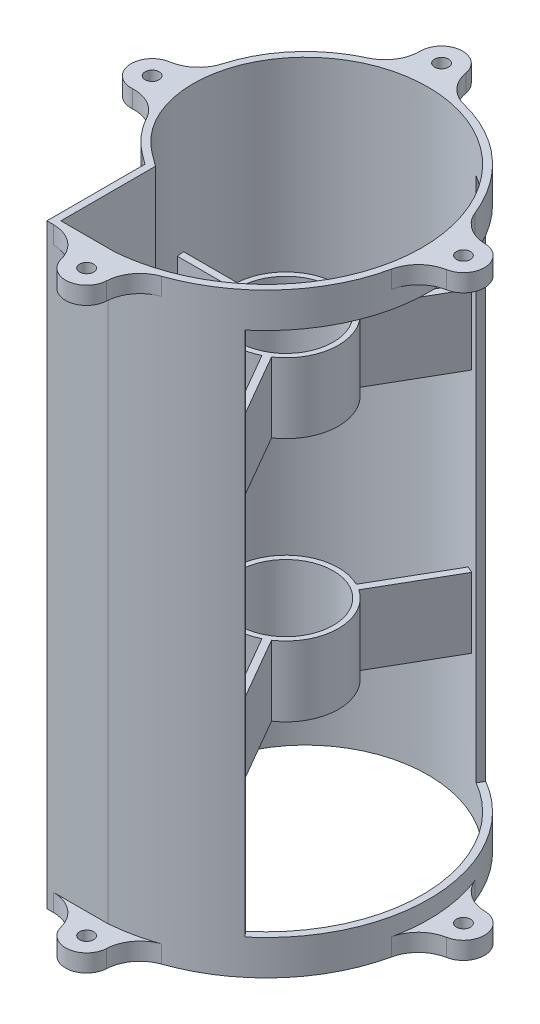
from build123d import *

# Parameters (mm, degrees)
BOSS_EXTRUDE1_DEPTH     = 170
SKETCH5_3_R             = 6
SKETCH5_3_R_2           = 2
BOSS_EXTRUDE2_DEPTH     = 5
BOSS_EXTRUDE3_START     = -165
SKETCH5_4_R             = 6
SKETCH5_4_R_2           = 2
BOSS_EXTRUDE3_DEPTH     = 5
BOSS_EXTRUDE4_START     = -40
SKETCH6_R               = 15
SKETCH6_R_2             = 13.5
BOSS_EXTRUDE4_DEPTH     = 20
BOSS_EXTRUDE5_START     = -130
BOSS_EXTRUDE5_OUTLINE_R = 13.5
BOSS_EXTRUDE5_DEPTH     = 20
CUT_EXTRUDE1_START      = -10
CUT_EXTRUDE1_DEPTH      = 150


# Read off the part's stored shape, not the designer's step: Boss-Extrude5
with BuildPart() as part:
    # Sketch5 → Boss-Extrude1 (new body)
    with BuildSketch(Plane(origin=(0, 0, 0), x_dir=(1, 0, 0), z_dir=(0, 1, 0))):
        with BuildLine():
            add(Edge.make_bspline(
                [(-20.284806523, -20.697166147), (-21.647349282, -19.684628715), (-24.119876423, -17.487215029), (-26.521142183, -14.482412357), (-28.133703758, -11.951961048), (-29.652422792, -9.185663116), (-30.974716714, -5.758772787), (-32.056848653, -1.249302628), (-32.484723085, 2.832387859), (-32.298334481, 6.996928933), (-31.67751169, 11.165076454), (-30.558556828, 15.070848597), (-27.690305049, 21.551018706), (-22.847250329, 28.074967355), (-15.468817121, 33.530688185), (-9.913327734, 36.09195539), (-5.810944088, 37.369461116), (-1.635876871, 38.286376333), (2.643306278, 38.67228751), (6.934651208, 38.518823782), (11.233189994, 38.009461291), (18.419798413, 36.233096755), (28.406731461, 31.050278753), (36.149602779, 22.96265335), (40.631649152, 15.13900289), (42.553931903, 10.306844764), (43.70793417, 6.061253764), (44.536683673, 1.759406891), (44.883797443, -2.636875779), (44.743754077, -7.029105777), (44.282387222, -11.426694793), (43.03375203, -17.158865746), (39.358782218, -26.649232757), (32.967215553, -35.534238949), (24.30152126, -42.623106564), (18.394766853, -45.948962523), (14.06903476, -47.736845229), (11.362814445, -48.684248187), (8.290318717, -49.580816442), (4.432881146, -50.401863914), (1.532426722, -50.75686291), (0.081274739, -50.875)],
                knots=[0, 0, 0, 0, 0.031259421, 0.061044233, 0.068859088, 0.084488799, 0.11657261, 0.13220232, 0.163461741, 0.185156677, 0.200786388, 0.232045809, 0.250075368, 0.31259421, 0.35533086, 0.386049678, 0.401620291, 0.417190905, 0.447064906, 0.462001906, 0.476938907, 0.506812908, 0.562669578, 0.62518842, 0.649396808, 0.676419158, 0.689930334, 0.703733536, 0.730171833, 0.743390981, 0.756610129, 0.783048426, 0.812744946, 0.875263788, 0.906523209, 0.93778263, 0.949935808, 0.957750663, 0.969042051, 0.984671761, 1.000301472, 1.000301472, 1.000301472, 1.000301472], degree=3))
            Line((0.081274739, -50.875), (-17.346722006, -50.875))
            Line((-17.346722006, -50.875), (-17.346722006, -22.880525557))
            Line((-17.346722006, -22.880525557), (-20.284806523, -20.697166147))
        make_face()
        with BuildLine():
            Line((-19.091883092, -19.091883092), (-15.346722006, -21.875))
            Line((-15.346722006, -21.875), (-15.346722006, -48.875))
            Line((-15.346722006, -48.875), (0, -48.875))
            add(Edge.make_bspline(
                [(-19.091883092, -19.091883092), (-20.346373407, -18.159641961), (-21.534500259, -17.105433619), (-23.732871388, -14.775446479), (-24.743062189, -13.499686256), (-26.544205363, -10.757384747), (-27.335107738, -9.290871933), (-28.661787584, -6.205556015), (-29.197520359, -4.586790607), (-29.984871355, -1.242166207), (-30.236451872, 0.483646875), (-30.43464802, 3.991722319), (-30.381234435, 5.773931869), (-29.957740861, 9.340194634), (-29.587641391, 11.124189719), (-28.52895847, 14.63712725), (-27.840366222, 16.366008053), (-26.153191727, 19.711333954), (-25.154611982, 21.327715866), (-22.866364526, 24.392054471), (-21.576710867, 25.839948515), (-18.735378004, 28.514611155), (-17.183724268, 29.74131975), (-13.857020421, 31.926048607), (-12.082006674, 32.884013594), (-8.355848884, 34.490566919), (-6.404751203, 35.139106683), (-2.381083742, 36.094561163), (-0.308569074, 36.401435807), (3.897409442, 36.651088107), (6.030811004, 36.593835759), (10.293943116, 36.103595602), (12.42360606, 35.670589127), (16.61249937, 34.428770402), (18.671658886, 33.619951755), (22.652727582, 31.638385742), (24.574564901, 30.465644795), (28.216264815, 27.780060074), (29.936056862, 26.267235672), (33.113180479, 22.936872084), (34.570445154, 21.119364941), (37.168337692, 17.22581337), (38.308904588, 15.14981295), (40.227461412, 10.795097875), (41.005398438, 8.516438081), (42.162707814, 3.820385091), (42.542037254, 1.403056115), (42.877540716, -3.499989055), (42.833683466, -5.985633503), (42.310738689, -10.950645077), (41.831632837, -13.429935053), (40.439380604, -18.305496801), (39.526229768, -20.701688368), (37.280686856, -25.334605804), (35.948304685, -27.571250912), (32.892627712, -31.811345756), (31.169357216, -33.814716752), (27.373248038, -37.519654147), (25.300447645, -39.221146401), (20.858697904, -42.261140805), (18.489799945, -43.59957589), (13.520000031, -45.861821928), (10.919161244, -46.785575206), (5.558626425, -48.178255061), (2.799003611, -48.647135417), (0, -48.875)],
                knots=[0, 0, 0, 0, 0.03125, 0.03125, 0.0625, 0.0625, 0.09375, 0.09375, 0.125, 0.125, 0.15625, 0.15625, 0.1875, 0.1875, 0.21875, 0.21875, 0.25, 0.25, 0.28125, 0.28125, 0.3125, 0.3125, 0.34375, 0.34375, 0.375, 0.375, 0.40625, 0.40625, 0.4375, 0.4375, 0.46875, 0.46875, 0.5, 0.5, 0.53125, 0.53125, 0.5625, 0.5625, 0.59375, 0.59375, 0.625, 0.625, 0.65625, 0.65625, 0.6875, 0.6875, 0.71875, 0.71875, 0.75, 0.75, 0.78125, 0.78125, 0.8125, 0.8125, 0.84375, 0.84375, 0.875, 0.875, 0.90625, 0.90625, 0.9375, 0.9375, 0.96875, 0.96875, 1, 1, 1, 1], degree=3))
        make_face(mode=Mode.SUBTRACT)
    extrude(amount=-BOSS_EXTRUDE1_DEPTH)

    # Sketch5<3> → Boss-Extrude2 (add)
    # profile 1 of 12: a face of its own
    with BuildSketch(Plane(origin=(0, 0, 0), x_dir=(1, 0, 0), z_dir=(0, 1, 0))):
        with BuildLine():
            Line((1e-08, -50.875), (-15.491933385, -50.875))
            ThreePointArc((-15.491933385, -50.875), (-9.368209028, -52.96930585), (-5.809475019, -58.375))
            ThreePointArc((-5.809475019, -58.375), (-4.743416487, -53.200765382), (1e-08, -50.875))
        make_face()
    # profile 2 of 12: a face of its own
    with BuildSketch(Plane(origin=(0, 0, 0), x_dir=(1, 0, 0), z_dir=(0, 1, 0))):
        with BuildLine():
            Line((0.081274739, -50.875), (1e-08, -50.875))
            ThreePointArc((1e-08, -50.875), (4.242640691, -52.632359317), (6, -56.875))
            ThreePointArc((6, -56.875), (5.998199958, -57.021960057), (5.992800914, -57.168831935))
            ThreePointArc((5.992800914, -57.168831935), (7.969073018, -51.674222984), (12.677054746, -48.220053473))
            add(Edge.make_bspline(
                [(12.677054746, -48.220053473), (12.338840874, -48.33843812), (11.017191146, -48.78510264), (8.290318717, -49.580816442), (4.432881146, -50.401863914), (1.532426722, -50.75686291), (0.081274739, -50.875)],
                knots=[0.953843236, 0.953843236, 0.953843236, 0.953843236, 0.957750663, 0.969042051, 0.984671761, 1.000301472, 1.000301472, 1.000301472, 1.000301472], degree=3))
        make_face()
    # profile 3 of 12: a face of its own
    with BuildSketch(Plane(origin=(0, 0, 0), x_dir=(1, 0, 0), z_dir=(0, 1, 0))):
        with Locations((0, -56.875)):
            Circle(SKETCH5_3_R)
        with Locations(Location((0, -56.875, 0), (0, 0, 270))):
            Circle(SKETCH5_3_R_2, mode=Mode.SUBTRACT)
    # profile 4 of 12: a face of its own
    with BuildSketch(Plane(origin=(0, 0, 0), x_dir=(1, 0, 0), z_dir=(0, 1, 0))):
        with BuildLine():
            ThreePointArc((6, 44.413992336), (4.427597407, 40.364747814), (0.534539599, 38.437850821))
            add(Edge.make_bspline(
                [(0.53453958, 38.437850819), (1.589491803, 38.532211656), (3.71614251, 38.633921578), (6.934651208, 38.518823782), (10.158555298, 38.136801913), (12.296770506, 37.70047382), (13.359260458, 37.437073729)],
                knots=[0.432127905, 0.432127905, 0.432127905, 0.432127905, 0.447064906, 0.462001906, 0.476938907, 0.491875907, 0.491875907, 0.491875907, 0.491875907], degree=3))
            ThreePointArc((13.359260458, 37.437073729), (8.44590485, 40.329779913), (5.912063981, 45.437466558))
            ThreePointArc((5.912063981, 45.437466558), (5.977975572, 44.927614821), (6, 44.413992336))
        make_face()
    # profile 5 of 12: a face of its own
    with BuildSketch(Plane(origin=(0, 0, 0), x_dir=(1, 0, 0), z_dir=(0, 1, 0))):
        with Locations((0, 44.413992336)):
            Circle(SKETCH5_3_R)
        with Locations(Location((0, 44.413992336, 0), (0, 0, 270))):
            Circle(SKETCH5_3_R_2, mode=Mode.SUBTRACT)
    # profile 6 of 12: a face of its own
    with BuildSketch(Plane(origin=(0, 0, 0), x_dir=(1, 0, 0), z_dir=(0, 1, 0))):
        with BuildLine():
            ThreePointArc((-5.999678022, 44.351834195), (-7.551470641, 38.896895507), (-11.820407259, 35.163184675))
            add(Edge.make_bspline(
                [(-11.820407259, 35.163184675), (-10.865031128, 35.602616675), (-8.894735059, 36.409150974), (-5.810944088, 37.369461116), (-2.657965676, 38.061908383), (-0.520412642, 38.343489982), (0.53453958, 38.437850819)],
                knots=[0.370690269, 0.370690269, 0.370690269, 0.370690269, 0.386049678, 0.401620291, 0.417190905, 0.432127905, 0.432127905, 0.432127905, 0.432127905], degree=3))
            ThreePointArc((0.534539599, 38.437850821), (-4.026255622, 39.965479589), (-5.999678022, 44.351834195))
        make_face()
    # profile 7 of 12: a face of its own
    with BuildSketch(Plane(origin=(0, 0, 0), x_dir=(1, 0, 0), z_dir=(0, 1, 0))):
        with BuildLine():
            add(Edge.make_bspline(
                [(41.715260186, 12.305406159), (42.114692999, 11.299529523), (42.840881953, 9.251151387), (43.70793417, 6.061253764), (44.332873116, 2.817340325), (44.587550319, 0.614745325), (44.672618479, -0.469365886)],
                knots=[0.662907983, 0.662907983, 0.662907983, 0.662907983, 0.676419158, 0.689930334, 0.703733536, 0.716952685, 0.716952685, 0.716952685, 0.716952685], degree=3))
            ThreePointArc((44.672618484, -0.469365948), (46.294239715, 4.121949862), (50.787380227, 5.998522439))
            ThreePointArc((50.787380227, 5.998522439), (45.301184937, 7.785244759), (41.715260186, 12.305406159))
        make_face()
    # profile 8 of 12: a face of its own
    with BuildSketch(Plane(origin=(0, 0, 0), x_dir=(1, 0, 0), z_dir=(0, 1, 0))):
        with Locations((50.654231611, 0)):
            Circle(SKETCH5_3_R)
        with Locations(Location((50.654231611, 0, 0), (0, 0, 270))):
            Circle(SKETCH5_3_R_2, mode=Mode.SUBTRACT)
    # profile 9 of 12: a face of its own
    with BuildSketch(Plane(origin=(0, 0, 0), x_dir=(1, 0, 0), z_dir=(0, 1, 0))):
        with BuildLine():
            add(Edge.make_bspline(
                [(44.672618479, -0.469365886), (44.757686638, -1.553477097), (44.848786601, -3.734933279), (44.743754077, -7.029105777), (44.397728936, -10.327297539), (44.003507854, -12.51699589), (43.765769941, -13.606556627)],
                knots=[0.716952685, 0.716952685, 0.716952685, 0.716952685, 0.730171833, 0.743390981, 0.756610129, 0.769829277, 0.769829277, 0.769829277, 0.769829277], degree=3))
            ThreePointArc((43.765769941, -13.606556627), (46.585108165, -8.549027302), (51.734856686, -5.901885245))
            ThreePointArc((51.734856686, -5.901885245), (46.995955043, -4.755734701), (44.672618484, -0.469365948))
        make_face()
    # profile 10 of 12: a face of its own
    with BuildSketch(Plane(origin=(0, 0, 0), x_dir=(1, 0, 0), z_dir=(0, 1, 0))):
        with Locations((-38.17963179, 0)):
            Circle(SKETCH5_3_R)
        with Locations(Location((-38.17963179, 0, 0), (0, 0, 270))):
            Circle(SKETCH5_3_R_2, mode=Mode.SUBTRACT)
    # profile 11 of 12: a face of its own
    with BuildSketch(Plane(origin=(0, 0, 0), x_dir=(1, 0, 0), z_dir=(0, 1, 0))):
        with BuildLine():
            ThreePointArc((-37.857563391, -5.99134976), (-32.459204191, -7.238222596), (-28.553202486, -11.167614991))
            add(Edge.make_bspline(
                [(-28.553202486, -11.167614991), (-28.766632046, -10.77852429), (-29.815558382, -8.762876799), (-30.974716714, -5.758772787), (-31.842681524, -2.141781855), (-32.115471416, -0.30655346), (-32.211764693, 0.620130878)],
                knots=[0.076673943, 0.076673943, 0.076673943, 0.076673943, 0.084488799, 0.11657261, 0.13220232, 0.147832031, 0.147832031, 0.147832031, 0.147832031], degree=3))
            ThreePointArc((-32.211764693, 0.620130878), (-32.187670401, 0.310481412), (-32.17963179, 0))
            ThreePointArc((-32.17963179, 0), (-33.824611102, -4.127201812), (-37.857563391, -5.99134976))
        make_face()
    # profile 12 of 12: a face of its own
    with BuildSketch(Plane(origin=(0, 0, 0), x_dir=(1, 0, 0), z_dir=(0, 1, 0))):
        with BuildLine():
            ThreePointArc((-39.127786336, 5.924609941), (-34.5280906, 4.760908205), (-32.211764693, 0.620130878))
            add(Edge.make_bspline(
                [(-32.211764693, 0.620130878), (-32.308057964, 1.546815161), (-32.442246747, 3.781450461), (-32.298334481, 6.996928933), (-31.818991787, 10.215192002), (-31.365474901, 12.102244133), (-31.096538158, 13.038713992)],
                knots=[0.147832031, 0.147832031, 0.147832031, 0.147832031, 0.163461741, 0.185156677, 0.200786388, 0.216416098, 0.216416098, 0.216416098, 0.216416098], degree=3))
            ThreePointArc((-31.096538158, 13.038713992), (-34.077319161, 8.313407808), (-39.127786336, 5.924609941))
        make_face()
    extrude(amount=-BOSS_EXTRUDE2_DEPTH)

    # Sketch5<4> → Boss-Extrude3 (add)
    # profile 1 of 12: a face of its own
    with BuildSketch(Plane(origin=(0, 0, 0), x_dir=(1, 0, 0), z_dir=(0, 1, 0)).offset(BOSS_EXTRUDE3_START)):
        with BuildLine():
            Line((1e-08, -50.875), (-15.491933385, -50.875))
            ThreePointArc((-15.491933385, -50.875), (-9.368209028, -52.96930585), (-5.809475019, -58.375))
            ThreePointArc((-5.809475019, -58.375), (-4.743416487, -53.200765382), (1e-08, -50.875))
        make_face()
    # profile 2 of 12: a face of its own
    with BuildSketch(Plane(origin=(0, 0, 0), x_dir=(1, 0, 0), z_dir=(0, 1, 0)).offset(BOSS_EXTRUDE3_START)):
        with Locations((0, -56.875)):
            Circle(SKETCH5_4_R)
        with Locations(Location((0, -56.875, 0), (0, 0, 270))):
            Circle(SKETCH5_4_R_2, mode=Mode.SUBTRACT)
    # profile 3 of 12: a face of its own
    with BuildSketch(Plane(origin=(0, 0, 0), x_dir=(1, 0, 0), z_dir=(0, 1, 0)).offset(BOSS_EXTRUDE3_START)):
        with BuildLine():
            Line((0.081274739, -50.875), (1e-08, -50.875))
            ThreePointArc((1e-08, -50.875), (4.242640691, -52.632359317), (6, -56.875))
            ThreePointArc((6, -56.875), (5.998199958, -57.021960057), (5.992800914, -57.168831935))
            ThreePointArc((5.992800914, -57.168831935), (7.969073018, -51.674222984), (12.677054746, -48.220053473))
            add(Edge.make_bspline(
                [(12.677054746, -48.220053473), (12.338840874, -48.33843812), (11.017191146, -48.78510264), (8.290318717, -49.580816442), (4.432881146, -50.401863914), (1.532426722, -50.75686291), (0.081274739, -50.875)],
                knots=[0.953843236, 0.953843236, 0.953843236, 0.953843236, 0.957750663, 0.969042051, 0.984671761, 1.000301472, 1.000301472, 1.000301472, 1.000301472], degree=3))
        make_face()
    # profile 4 of 12: a face of its own
    with BuildSketch(Plane(origin=(0, 0, 0), x_dir=(1, 0, 0), z_dir=(0, 1, 0)).offset(BOSS_EXTRUDE3_START)):
        with BuildLine():
            ThreePointArc((-5.999678022, 44.351834195), (-7.551470641, 38.896895507), (-11.820407259, 35.163184675))
            add(Edge.make_bspline(
                [(-11.820407259, 35.163184675), (-10.865031128, 35.602616675), (-8.894735059, 36.409150974), (-5.810944088, 37.369461116), (-2.657965676, 38.061908383), (-0.520412642, 38.343489982), (0.53453958, 38.437850819)],
                knots=[0.370690269, 0.370690269, 0.370690269, 0.370690269, 0.386049678, 0.401620291, 0.417190905, 0.432127905, 0.432127905, 0.432127905, 0.432127905], degree=3))
            ThreePointArc((0.534539599, 38.437850821), (-4.026255622, 39.965479589), (-5.999678022, 44.351834195))
        make_face()
    # profile 5 of 12: a face of its own
    with BuildSketch(Plane(origin=(0, 0, 0), x_dir=(1, 0, 0), z_dir=(0, 1, 0)).offset(BOSS_EXTRUDE3_START)):
        with Locations((0, 44.413992336)):
            Circle(SKETCH5_4_R)
        with Locations(Location((0, 44.413992336, 0), (0, 0, 270))):
            Circle(SKETCH5_4_R_2, mode=Mode.SUBTRACT)
    # profile 6 of 12: a face of its own
    with BuildSketch(Plane(origin=(0, 0, 0), x_dir=(1, 0, 0), z_dir=(0, 1, 0)).offset(BOSS_EXTRUDE3_START)):
        with BuildLine():
            ThreePointArc((6, 44.413992336), (4.427597407, 40.364747814), (0.534539599, 38.437850821))
            add(Edge.make_bspline(
                [(0.53453958, 38.437850819), (1.589491803, 38.532211656), (3.71614251, 38.633921578), (6.934651208, 38.518823782), (10.158555298, 38.136801913), (12.296770506, 37.70047382), (13.359260458, 37.437073729)],
                knots=[0.432127905, 0.432127905, 0.432127905, 0.432127905, 0.447064906, 0.462001906, 0.476938907, 0.491875907, 0.491875907, 0.491875907, 0.491875907], degree=3))
            ThreePointArc((13.359260458, 37.437073729), (8.44590485, 40.329779913), (5.912063981, 45.437466558))
            ThreePointArc((5.912063981, 45.437466558), (5.977975572, 44.927614821), (6, 44.413992336))
        make_face()
    # profile 7 of 12: a face of its own
    with BuildSketch(Plane(origin=(0, 0, 0), x_dir=(1, 0, 0), z_dir=(0, 1, 0)).offset(BOSS_EXTRUDE3_START)):
        with BuildLine():
            add(Edge.make_bspline(
                [(44.672618479, -0.469365886), (44.757686638, -1.553477097), (44.848786601, -3.734933279), (44.743754077, -7.029105777), (44.397728936, -10.327297539), (44.003507854, -12.51699589), (43.765769941, -13.606556627)],
                knots=[0.716952685, 0.716952685, 0.716952685, 0.716952685, 0.730171833, 0.743390981, 0.756610129, 0.769829277, 0.769829277, 0.769829277, 0.769829277], degree=3))
            ThreePointArc((43.765769941, -13.606556627), (46.585108165, -8.549027302), (51.734856686, -5.901885245))
            ThreePointArc((51.734856686, -5.901885245), (46.995955043, -4.755734701), (44.672618484, -0.469365948))
        make_face()
    # profile 8 of 12: a face of its own
    with BuildSketch(Plane(origin=(0, 0, 0), x_dir=(1, 0, 0), z_dir=(0, 1, 0)).offset(BOSS_EXTRUDE3_START)):
        with Locations((50.654231611, 0)):
            Circle(SKETCH5_4_R)
        with Locations(Location((50.654231611, 0, 0), (0, 0, 270))):
            Circle(SKETCH5_4_R_2, mode=Mode.SUBTRACT)
    # profile 9 of 12: a face of its own
    with BuildSketch(Plane(origin=(0, 0, 0), x_dir=(1, 0, 0), z_dir=(0, 1, 0)).offset(BOSS_EXTRUDE3_START)):
        with BuildLine():
            add(Edge.make_bspline(
                [(41.715260186, 12.305406159), (42.114692999, 11.299529523), (42.840881953, 9.251151387), (43.70793417, 6.061253764), (44.332873116, 2.817340325), (44.587550319, 0.614745325), (44.672618479, -0.469365886)],
                knots=[0.662907983, 0.662907983, 0.662907983, 0.662907983, 0.676419158, 0.689930334, 0.703733536, 0.716952685, 0.716952685, 0.716952685, 0.716952685], degree=3))
            ThreePointArc((44.672618484, -0.469365948), (46.294239715, 4.121949862), (50.787380227, 5.998522439))
            ThreePointArc((50.787380227, 5.998522439), (45.301184937, 7.785244759), (41.715260186, 12.305406159))
        make_face()
    # profile 10 of 12: a face of its own
    with BuildSketch(Plane(origin=(0, 0, 0), x_dir=(1, 0, 0), z_dir=(0, 1, 0)).offset(BOSS_EXTRUDE3_START)):
        with Locations((-38.17963179, 0)):
            Circle(SKETCH5_4_R)
        with Locations(Location((-38.17963179, 0, 0), (0, 0, 270))):
            Circle(SKETCH5_4_R_2, mode=Mode.SUBTRACT)
    # profile 11 of 12: a face of its own
    with BuildSketch(Plane(origin=(0, 0, 0), x_dir=(1, 0, 0), z_dir=(0, 1, 0)).offset(BOSS_EXTRUDE3_START)):
        with BuildLine():
            ThreePointArc((-39.127786336, 5.924609941), (-34.5280906, 4.760908205), (-32.211764693, 0.620130878))
            add(Edge.make_bspline(
                [(-32.211764693, 0.620130878), (-32.308057964, 1.546815161), (-32.442246747, 3.781450461), (-32.298334481, 6.996928933), (-31.818991787, 10.215192002), (-31.365474901, 12.102244133), (-31.096538158, 13.038713992)],
                knots=[0.147832031, 0.147832031, 0.147832031, 0.147832031, 0.163461741, 0.185156677, 0.200786388, 0.216416098, 0.216416098, 0.216416098, 0.216416098], degree=3))
            ThreePointArc((-31.096538158, 13.038713992), (-34.077319161, 8.313407808), (-39.127786336, 5.924609941))
        make_face()
    # profile 12 of 12: a face of its own
    with BuildSketch(Plane(origin=(0, 0, 0), x_dir=(1, 0, 0), z_dir=(0, 1, 0)).offset(BOSS_EXTRUDE3_START)):
        with BuildLine():
            ThreePointArc((-37.857563391, -5.99134976), (-32.459204191, -7.238222596), (-28.553202486, -11.167614991))
            add(Edge.make_bspline(
                [(-28.553202486, -11.167614991), (-28.766632046, -10.77852429), (-29.815558382, -8.762876799), (-30.974716714, -5.758772787), (-31.842681524, -2.141781855), (-32.115471416, -0.30655346), (-32.211764693, 0.620130878)],
                knots=[0.076673943, 0.076673943, 0.076673943, 0.076673943, 0.084488799, 0.11657261, 0.13220232, 0.147832031, 0.147832031, 0.147832031, 0.147832031], degree=3))
            ThreePointArc((-32.211764693, 0.620130878), (-32.187670401, 0.310481412), (-32.17963179, 0))
            ThreePointArc((-32.17963179, 0), (-33.824611102, -4.127201812), (-37.857563391, -5.99134976))
        make_face()
    extrude(amount=-BOSS_EXTRUDE3_DEPTH)

    # Sketch6 → Boss-Extrude4 (add)
    # profile 1 of 4: a face of its own
    with BuildSketch(Plane.XZ.offset(170).offset(BOSS_EXTRUDE4_START)):
        with BuildLine():
            add(Edge.make_bspline(
                [(-29.975571565, 1), (-30.085714904, 0.339414681), (-30.174044769, -0.327738488), (-30.239961362, -1)],
                knots=[0.136791219, 0.136791219, 0.136791219, 0.136791219, 0.148869765, 0.148869765, 0.148869765, 0.148869765], degree=3))
            Line((-30.239961362, -1), (-14.966629547, -1))
            ThreePointArc((-14.966629547, -1), (-15, 0), (-14.966629547, 1))
            Line((-14.966629547, 1), (-29.975571565, 1))
        make_face()
    # profile 2 of 4: a face of its own
    with BuildSketch(Plane.XZ.offset(170).offset(BOSS_EXTRUDE4_START)):
        with BuildLine():
            Line((6.61728937, -13.461481397), (18.304705612, -33.704680137))
            add(Edge.make_bspline(
                [(18.304705612, -33.704680137), (18.921977062, -33.447962214), (19.534150304, -33.174355021), (20.14030036, -32.884023503)],
                knots=[0.519066452, 0.519066452, 0.519066452, 0.519066452, 0.528526947, 0.528526947, 0.528526947, 0.528526947], degree=3))
            Line((20.14030036, -32.884023503), (8.349340177, -12.461481397))
            ThreePointArc((8.349340177, -12.461481397), (7.5, -12.990381057), (6.61728937, -13.461481397))
        make_face()
    # profile 3 of 4: a face of its own
    with BuildSketch(Plane.XZ.offset(170).offset(BOSS_EXTRUDE4_START)):
        with BuildLine():
            Line((22.566912856, 41.087039636), (6.61728937, 13.461481397))
            ThreePointArc((6.61728937, 13.461481397), (7.5, 12.990381057), (8.349340177, 12.461481397))
            Line((8.349340177, 12.461481397), (24.213890355, 39.939688344))
            add(Edge.make_bspline(
                [(24.213890355, 39.939688344), (23.840268721, 40.212121058), (23.462117425, 40.479324801), (22.909548909, 40.857510267), (22.73865748, 40.972812796), (22.566912856, 41.087039636)],
                knots=[0.900867202, 0.900867202, 0.900867202, 0.900867202, 0.90625, 0.90625, 0.908642411, 0.908642411, 0.908642411, 0.908642411], degree=3))
        make_face()
    # profile 4 of 4: a face of its own
    with BuildSketch(Plane.XZ.offset(170).offset(BOSS_EXTRUDE4_START)):
        Circle(SKETCH6_R)
        with Locations(Location((0, 0, 0), (0, 0, 270))):
            Circle(SKETCH6_R_2, mode=Mode.SUBTRACT)
    extrude(amount=-BOSS_EXTRUDE4_DEPTH)

    # Boss-Extrude5 outline → Boss-Extrude5 (add)
    with BuildSketch(Plane.XZ.offset(170).offset(BOSS_EXTRUDE5_START)):
        with BuildLine():
            Line((-30.239961362, -1), (-14.966629547, -1))
            ThreePointArc((-14.966629547, -1), (-7.5, -12.990381057), (6.61728937, -13.461481397))
            Line((6.61728937, -13.461481397), (18.304705612, -33.704680137))
            add(Edge.make_bspline(
                [(18.304705612, -33.704680137), (18.921977062, -33.447962214), (19.534150304, -33.174355021), (20.14030036, -32.884023503)],
                knots=[0.519066452, 0.519066452, 0.519066452, 0.519066452, 0.528526947, 0.528526947, 0.528526947, 0.528526947], degree=3))
            Line((20.14030036, -32.884023503), (8.349340177, -12.461481397))
            ThreePointArc((8.349340177, -12.461481397), (15, 0), (8.349340177, 12.461481397))
            Line((8.349340177, 12.461481397), (24.213890355, 39.939688344))
            add(Edge.make_bspline(
                [(24.213890355, 39.939688344), (23.840268721, 40.212121058), (23.462117425, 40.479324801), (22.909548909, 40.857510267), (22.73865748, 40.972812796), (22.566912856, 41.087039636)],
                knots=[0.900867202, 0.900867202, 0.900867202, 0.900867202, 0.90625, 0.90625, 0.908642411, 0.908642411, 0.908642411, 0.908642411], degree=3))
            Line((22.566912856, 41.087039636), (6.61728937, 13.461481397))
            ThreePointArc((6.61728937, 13.461481397), (-7.5, 12.990381057), (-14.966629547, 1))
            Line((-14.966629547, 1), (-29.975571565, 1))
            add(Edge.make_bspline(
                [(-29.975571565, 1), (-30.085714904, 0.339414681), (-30.174044769, -0.327738488), (-30.239961362, -1)],
                knots=[0.136791219, 0.136791219, 0.136791219, 0.136791219, 0.148869765, 0.148869765, 0.148869765, 0.148869765], degree=3))
        make_face()
        Circle(BOSS_EXTRUDE5_OUTLINE_R, mode=Mode.SUBTRACT)
    extrude(amount=BOSS_EXTRUDE5_DEPTH)

    # Sketch7 → Cut-Extrude1 (cut)
    with BuildSketch(Plane.XZ.offset(170).offset(CUT_EXTRUDE1_START)):
        with BuildLine():
            Line((24.298022399, -34.078755541), (22.795142145, -31.482344375))
            add(Edge.make_bspline(
                [(22.795142145, -31.482344375), (24.030753051, -30.767135914), (25.233639684, -29.979607722), (28.216264815, -27.780060074), (29.936056862, -26.267235672), (33.113180479, -22.936872084), (34.570445154, -21.119364941), (37.168337692, -17.22581337), (38.308904588, -15.14981295), (40.227461412, -10.795097875), (41.005398438, -8.516438081), (42.162707814, -3.820385091), (42.542037254, -1.403056115), (42.877540716, 3.499989055), (42.833683466, 5.985633503), (42.310738689, 10.950645077), (41.831632837, 13.429935053), (40.439380604, 18.305496801), (39.526229768, 20.701688368), (37.280686856, 25.334605804), (35.948304685, 27.571250912), (32.892627712, 31.811345756), (31.169357216, 33.814716752), (28.41621102, 36.50174018), (27.525653213, 37.305652913), (26.602067896, 38.076133183)],
                knots=[0.542561249, 0.542561249, 0.542561249, 0.542561249, 0.5625, 0.5625, 0.59375, 0.59375, 0.625, 0.625, 0.65625, 0.65625, 0.6875, 0.6875, 0.71875, 0.71875, 0.75, 0.75, 0.78125, 0.78125, 0.8125, 0.8125, 0.84375, 0.84375, 0.875, 0.875, 0.889078422, 0.889078422, 0.889078422, 0.889078422], degree=3))
            Line((26.602067896, 38.076133183), (28.523836476, 40.379783661))
            add(Edge.make_bspline(
                [(24.298022399, -34.078755541), (25.75143349, -33.237477835), (28.548916812, -31.385872604), (33.740290541, -26.972453201), (39.252343051, -20.247267814), (43.854486066, -10.62748894), (46.080999764, 0.031183518), (45.699325369, 11.140563679), (42.627123809, 22.056060593), (37.880329178, 30.450248638), (32.900237113, 36.420622237), (30.028663262, 39.124415773), (28.523836476, 40.379783661)],
                knots=[0.542561249, 0.542561249, 0.542561249, 0.542561249, 0.564218572, 0.585875895, 0.629190542, 0.672505189, 0.715819835, 0.759134482, 0.802449128, 0.845763775, 0.867421098, 0.889078422, 0.889078422, 0.889078422, 0.889078422], degree=3))
        make_face()
    extrude(amount=-CUT_EXTRUDE1_DEPTH, mode=Mode.SUBTRACT)


solid = part.part
